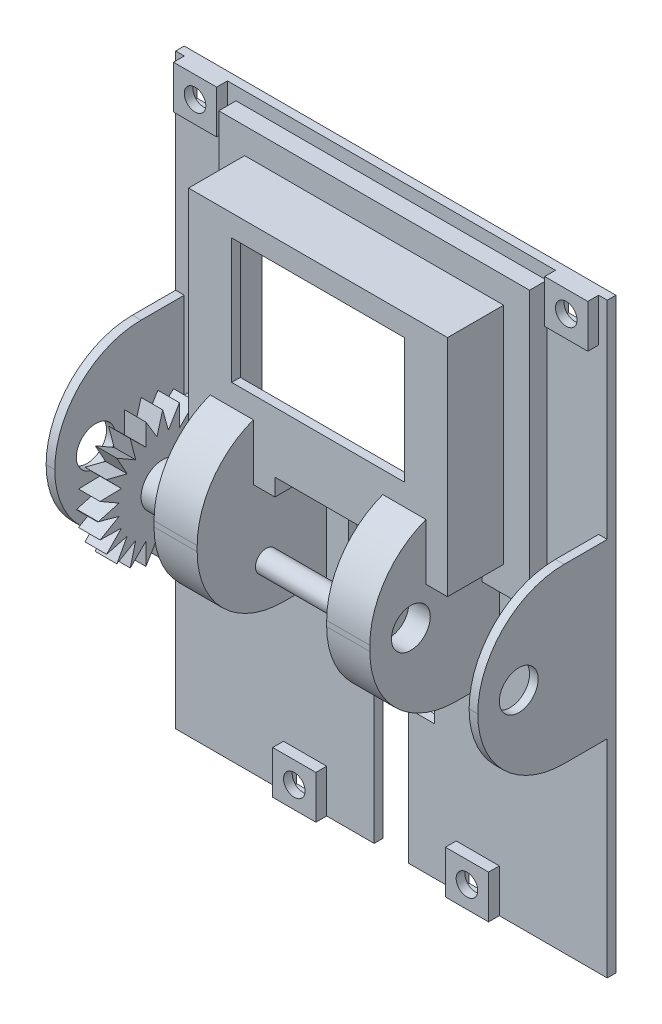
from build123d import *

# Parameters (mm, degrees)
BOSS_EXTRU_1_DEPTH       = 2
BOSS_EXTRU_2_DEPTH       = 4
ESQUISSE3_W              = 68
ESQUISSE3_H              = 60
ESQUISSE3_W_2            = 56
ESQUISSE3_H_2            = 48
BOSS_EXTRU_3_DEPTH       = 2
ESQUISSE4_W              = 60
ESQUISSE4_H              = 52
ESQUISSE4_W_2            = 56
ESQUISSE4_H_2            = 48
BOSS_EXTRU_4_DEPTH       = 13
ESQUISSE5_W              = 56
ESQUISSE5_H              = 48
BOSS_EXTRU_5_DEPTH       = 2
ESQUISSE6_W              = 20
ESQUISSE6_H              = 10
ENL_V_MAT_EXTRU_1_DEPTH  = 35
ESQUISSE9_W              = 2
ESQUISSE9_H              = 40
ESQUISSE9_W_2            = 10
ESQUISSE9_H_2            = 21
BOSS_EXTRU_9_DEPTH       = 30
CONG_5_R                 = 20
ESQUISSE10_W             = 10
ESQUISSE10_H             = 6
BOSS_EXTRU_10_DEPTH      = 26
ESQUISSE11_W             = 10
ESQUISSE11_H             = 13
BOSS_EXTRU_11_DEPTH      = 13
CONG_6_R                 = 20
CONG_7_R                 = 20
ESQUISSE12_R             = 2.5
BOSS_EXTRU_12_DEPTH      = 36
ESQUISSE13_R             = 4.5
ENL_V_MAT_EXTRU_2_DEPTH  = 30
ENL_V_START              = -17
ESQUISSE14_R             = 4.5
ENL_V_MAT_EXTRU_4_DEPTH  = 17
ESQUISSE15_R             = 5
BOSS_EXTRU_13_DEPTH      = 12.5
ESQUISSE16_W             = 1
ESQUISSE16_H             = 1
BOSS_EXTRU_14_DEPTH      = 2
ESQUISSE17_R             = 15
BOSS_EXTRU_16_DEPTH      = 5
ENL_V_START_2            = -16
ESQUISSE18_R             = 4.5
ENL_V_MAT_EXTRU_5_DEPTH  = 16
ENL_V_MAT_EXTRU_7_DEPTH  = 5
ESQUISSE24_W             = 40
ESQUISSE24_H             = 29
ENL_V_MAT_EXTRU_8_DEPTH  = 10
ESQUISSE25_R             = 2.5
ENL_V_MAT_EXTRU_9_DEPTH  = 10
ESQUISSE26_W             = 8
ESQUISSE26_H             = 31
ENL_V_MAT_EXTRU_10_DEPTH = 10
ESQUISSE27_W             = 8
ESQUISSE27_H             = 8
ENL_V_MAT_EXTRU_11_DEPTH = 2.5
ESQUISSE28_W             = 10
ESQUISSE28_H             = 10
ESQUISSE28_W_2           = 8
ESQUISSE28_H_2           = 8
BOSS_EXTRU_17_DEPTH      = 2.5
ESQUISSE29_W             = 8
ESQUISSE29_H             = 8
BOSS_EXTRU_18_DEPTH      = 2
ESQUISSE30_R             = 2.5
ENL_V_MAT_EXTRU_12_DEPTH = 2
ESQUISSE31_W             = 8
ESQUISSE31_H             = 8
ENL_V_MAT_EXTRU_13_DEPTH = 2.5
ESQUISSE32_W             = 10
ESQUISSE32_H             = 10
ESQUISSE32_W_2           = 8
ESQUISSE32_H_2           = 8
BOSS_EXTRU_19_DEPTH      = 2.5
ESQUISSE33_W             = 8
ESQUISSE33_H             = 8
BOSS_EXTRU_20_DEPTH      = 2
ESQUISSE34_R             = 2.5
ENL_V_MAT_EXTRU_14_DEPTH = 2


# Some blends are built 0.0001 mm under size
with BuildPart() as part:
    # Esquisse1 → Boss.-Extru.1 (new body)
    with BuildSketch(Plane.XY):
        Polygon((-50, 68), (-50, -68), (-10, -68), (10, -68), (50, -68), (50, 68), align=None)
        Polygon((-10, 3), (-34, 3), (-34, 63), (34, 63), (34, 3), (10, 3), (10, -37), (-10, -37), align=None, mode=Mode.SUBTRACT)
    extrude(amount=BOSS_EXTRU_1_DEPTH)

    # Esquisse2 → Boss.-Extru.2 (add)
    with BuildSketch(Plane.XY.offset(2)):
        Polygon((36, 65), (-36, 65), (-36, 1), (-10, 1), (-10, 3), (-34, 3), (-34, 63), (34, 63), (34, 3), (10, 3), (10, 1), (36, 1), align=None)
    extrude(amount=BOSS_EXTRU_2_DEPTH)

    # Esquisse3 → Boss.-Extru.3 (add)
    with BuildSketch(Plane.XY.offset(6)):
        with Locations((0, 33)):
            Rectangle(ESQUISSE3_W, ESQUISSE3_H)
        with Locations((0, 33)):
            Rectangle(ESQUISSE3_W_2, ESQUISSE3_H_2, mode=Mode.SUBTRACT)
    extrude(amount=-BOSS_EXTRU_3_DEPTH)

    # Esquisse4 → Boss.-Extru.4 (add)
    with BuildSketch(Plane.XY.offset(6)):
        with Locations((0, 33)):
            Rectangle(ESQUISSE4_W, ESQUISSE4_H)
        with Locations((0, 33)):
            Rectangle(ESQUISSE4_W_2, ESQUISSE4_H_2, mode=Mode.SUBTRACT)
    extrude(amount=BOSS_EXTRU_4_DEPTH)

    # Esquisse5 → Boss.-Extru.5 (add)
    with BuildSketch(Plane.XY.offset(19)):
        with Locations((0, 33)):
            Rectangle(ESQUISSE5_W, ESQUISSE5_H)
    extrude(amount=-BOSS_EXTRU_5_DEPTH)

    # Esquisse6 → Enlèv. mat.-Extru.1 (cut)
    with BuildSketch(Plane.XY.offset(19)):
        with Locations((0, 6)):
            Rectangle(ESQUISSE6_W, ESQUISSE6_H)
    extrude(amount=-ENL_V_MAT_EXTRU_1_DEPTH, mode=Mode.SUBTRACT)

    # Esquisse9 → Boss.-Extru.9 (add)
    with BuildSketch(Plane.XY.offset(2)):
        with Locations((-49, 0)):
            Rectangle(ESQUISSE9_W, ESQUISSE9_H)
        with Locations((49, 0)):
            Rectangle(ESQUISSE9_W, ESQUISSE9_H)
        with Locations((-20, -9.5)):
            Rectangle(ESQUISSE9_W_2, ESQUISSE9_H_2)
        with Locations((20, -9.5)):
            Rectangle(ESQUISSE9_W_2, ESQUISSE9_H_2)
    extrude(amount=BOSS_EXTRU_9_DEPTH)

    # Congé5
    cong_5_edges = [part.edges().sort_by_distance(p)[0] for p in [
        (49, -20, 32),
        (49, 20, 32),
        (-49, -20, 32),
        (-49, 20, 32),
    ]]
    fillet(cong_5_edges, radius=CONG_5_R - 0.0001)  # a hair under: the kernel refuses the full size

    # Esquisse10 → Boss.-Extru.10 (add)
    with BuildSketch(Plane.XY.offset(6)):
        with Locations((-20, 4)):
            Rectangle(ESQUISSE10_W, ESQUISSE10_H)
        with Locations((20, 4)):
            Rectangle(ESQUISSE10_W, ESQUISSE10_H)
    extrude(amount=BOSS_EXTRU_10_DEPTH)

    # Esquisse11 → Boss.-Extru.11 (add)
    with BuildSketch(Plane.XY.offset(19)):
        with Locations((-20, 13.5)):
            Rectangle(ESQUISSE11_W, ESQUISSE11_H)
        with Locations((20, 13.5)):
            Rectangle(ESQUISSE11_W, ESQUISSE11_H)
    extrude(amount=BOSS_EXTRU_11_DEPTH)

    # Congé6
    # the kernel refuses this fillet: 20 mm, written as the material it takes off along each edge
    with BuildSketch(Plane(origin=(71.837484988, 20, 32), x_dir=(0, -1, 0), z_dir=(-1, 0, 0)), Plane(origin=(31.837484988, 20, 32), x_dir=(0, -1, 0), z_dir=(-1, 0, 0))) as cong_6_piece_1:
        with BuildLine():
            CenterArc((18.734993995, -20), CONG_6_R, 90, 69.512684885)
            Line((0, -13), (-0.37469988, -12.86))
            ThreePointArc((-0.37469988, -12.86), (-0.4, -6.5), (-0.4, 0))
            Line((-0.4, 0), (0, 0.4))
            Line((0, 0.4), (18.734993995, 0.4))
            Line((18.734993995, 0.4), (18.734993995, 0))
        make_face()
    extrude(amount=103.674969976, mode=Mode.SUBTRACT)

    # Congé7
    cong_7_edges = [part.edges().sort_by_distance(p)[0] for p in [
        (-20, -20, 32),
        (20, -20, 32),
    ]]
    fillet(cong_7_edges, radius=CONG_7_R)

    # Esquisse12 → Boss.-Extru.12 (add)
    with BuildSketch(Plane(origin=(-15, 0, 0), x_dir=(0, 0, -1), z_dir=(1, 0, 0))):
        with Locations(Location((-16, -9.797958971, 0), (0, 0, 180))):
            Circle(ESQUISSE12_R)
    extrude(amount=BOSS_EXTRU_12_DEPTH)

    # Esquisse13 → Enlèv. mat.-Extru.2 (cut)
    with BuildSketch(Plane(origin=(50, 0, 0), x_dir=(0, 0, -1), z_dir=(1, 0, 0))):
        with Locations((-22.5, 0)):
            Circle(ESQUISSE13_R)
    extrude(amount=-ENL_V_MAT_EXTRU_2_DEPTH, mode=Mode.SUBTRACT)

    # Esquisse14 → Enlèv. mat.-Extru.4 (cut)
    with BuildSketch(Plane.ZY.offset(50).offset(ENL_V_START)):
        with Locations(Location((22.5, 0, 0), (0, 0, 180))):
            Circle(ESQUISSE14_R)
    extrude(amount=ENL_V_MAT_EXTRU_4_DEPTH, mode=Mode.SUBTRACT)

    # Esquisse15 → Boss.-Extru.13 (add)
    with BuildSketch(Plane.ZY.offset(25)):
        with Locations(Location((22.5, 0, 0), (0, 0, 180))):
            Circle(ESQUISSE15_R)
    extrude(amount=BOSS_EXTRU_13_DEPTH)

    # Esquisse16 → Boss.-Extru.14 (add)
    with BuildSketch(Plane.XY.offset(2)):
        with Locations((-37, 0.5)):
            Rectangle(ESQUISSE16_W, ESQUISSE16_H)
        with Locations((-37, -0.5)):
            Rectangle(ESQUISSE16_W, ESQUISSE16_H)
    extrude(amount=BOSS_EXTRU_14_DEPTH)

    # Esquisse17 → Boss.-Extru.16 (add)
    with BuildSketch(Plane.ZY.offset(37.5)):
        with Locations((22.5, 0)):
            Circle(ESQUISSE17_R)
    extrude(amount=-BOSS_EXTRU_16_DEPTH)

    # Esquisse18 → Enlèv. mat.-Extru.5 (cut)
    with BuildSketch(Plane.ZY.offset(50).offset(ENL_V_START_2)):
        with Locations(Location((22.5, 0, 0), (0, 0, 180))):
            Circle(ESQUISSE18_R)
    extrude(amount=ENL_V_MAT_EXTRU_5_DEPTH, mode=Mode.SUBTRACT)

    # Esquisse23 → Enlèv. mat.-Extru.7 (cut)
    with BuildSketch(Plane.ZY.offset(37.5)):
        with BuildLine():
            Line((16.249201679, 8.084145326), (14.992638885, 12.986128333))
            ThreePointArc((14.992638885, 12.986128333), (13.360150213, 11.893828058), (11.884385152, 10.597580922))
            Line((11.884385152, 10.597580922), (16.249201679, 8.084145326))
        make_face()
        with BuildLine():
            Line((18.613608679, 9.438661561), (18.613608679, 14.487786667))
            ThreePointArc((18.613608679, 14.487786667), (16.753858418, 13.855751763), (14.992638885, 12.986128333))
            Line((14.992638885, 12.986128333), (18.613608679, 9.438661561))
        make_face()
        with BuildLine():
            Line((21.172520791, 10.263058131), (22.5, 15))
            ThreePointArc((22.5, 15), (20.54, 14.871395362), (18.613608679, 14.487786667))
            Line((18.613608679, 14.487786667), (21.172520791, 10.263058131))
        make_face()
        with BuildLine():
            ThreePointArc((26.386391321, 14.487786667), (24.46, 14.871395362), (22.5, 15))
            Line((22.5, 15), (23.827479209, 10.263058131))
            Line((23.827479209, 10.263058131), (26.386391321, 14.487786667))
        make_face()
        with BuildLine():
            ThreePointArc((30.007361115, 12.986128333), (28.246141582, 13.855751763), (26.386391321, 14.487786667))
            Line((26.386391321, 14.487786667), (26.386391321, 9.438661561))
            Line((26.386391321, 9.438661561), (30.007361115, 12.986128333))
        make_face()
        with BuildLine():
            ThreePointArc((33.115614848, 10.597580922), (31.639849787, 11.893828058), (30.007361115, 12.986128333))
            Line((30.007361115, 12.986128333), (28.750798321, 8.084145326))
            Line((28.750798321, 8.084145326), (33.115614848, 10.597580922))
        make_face()
        with BuildLine():
            ThreePointArc((36.994373579, 3.861752784), (36.365501637, 5.722574977), (35.498873985, 7.485270545))
            Line((35.498873985, 7.485270545), (32.044534805, 3.971329591))
            Line((32.044534805, 3.971329591), (36.994373579, 3.861752784))
        make_face()
        with BuildLine():
            ThreePointArc((35.498873985, 7.485270545), (34.409350934, 9.119614045), (33.115614848, 10.597580922))
            Line((33.115614848, 10.597580922), (30.731443888, 6.271833446))
            Line((30.731443888, 6.271833446), (35.498873985, 7.485270545))
        make_face()
        with BuildLine():
            ThreePointArc((37.499978319, 0.025503813), (37.371395362, 1.96), (36.994373579, 3.861752784))
            Line((36.994373579, 3.861752784), (32.629557052, 1.348317188))
            Line((32.629557052, 1.348317188), (37.40956311, 0))
            Line((37.40956311, 0), (37.499978319, 0.025503813))
        make_face()
        with BuildLine():
            Line((37.499978319, -0.025503813), (37.40956311, 0))
            Line((37.40956311, 0), (32.629557052, -1.348317188))
            Line((32.629557052, -1.348317188), (36.994373579, -3.861752784))
            ThreePointArc((36.994373579, -3.861752784), (37.371395362, -1.96), (37.499978319, -0.025503813))
        make_face()
        with BuildLine():
            ThreePointArc((35.498873985, -7.485270545), (36.365501637, -5.722574977), (36.994373579, -3.861752784))
            Line((36.994373579, -3.861752784), (32.044534805, -3.971329591))
            Line((32.044534805, -3.971329591), (35.498873985, -7.485270545))
        make_face()
        with BuildLine():
            ThreePointArc((33.115614848, -10.597580922), (34.409350934, -9.119614045), (35.498873985, -7.485270545))
            Line((35.498873985, -7.485270545), (30.731443888, -6.271833446))
            Line((30.731443888, -6.271833446), (33.115614848, -10.597580922))
        make_face()
        with BuildLine():
            ThreePointArc((30.007361115, -12.986128333), (31.639849787, -11.893828058), (33.115614848, -10.597580922))
            Line((33.115614848, -10.597580922), (28.750798321, -8.084145326))
            Line((28.750798321, -8.084145326), (30.007361115, -12.986128333))
        make_face()
        with BuildLine():
            ThreePointArc((26.386391321, -14.487786667), (28.246141582, -13.855751763), (30.007361115, -12.986128333))
            Line((30.007361115, -12.986128333), (26.386391321, -9.438661561))
            Line((26.386391321, -9.438661561), (26.386391321, -14.487786667))
        make_face()
        with BuildLine():
            ThreePointArc((22.5, -15), (24.46, -14.871395362), (26.386391321, -14.487786667))
            Line((26.386391321, -14.487786667), (23.821374155, -10.252978772))
            Line((23.821374155, -10.252978772), (22.5, -15))
        make_face()
        with BuildLine():
            Line((21.172520791, -10.263058131), (18.613608679, -14.487786667))
            ThreePointArc((18.613608679, -14.487786667), (20.54, -14.871395362), (22.5, -15))
            Line((22.5, -15), (21.172520791, -10.263058131))
        make_face()
        with BuildLine():
            Line((18.613608679, -9.438661561), (14.992638885, -12.986128333))
            ThreePointArc((14.992638885, -12.986128333), (16.753858418, -13.855751763), (18.613608679, -14.487786667))
            Line((18.613608679, -14.487786667), (18.613608679, -9.438661561))
        make_face()
        with BuildLine():
            Line((16.249201679, -8.084145326), (11.884385152, -10.597580922))
            ThreePointArc((11.884385152, -10.597580922), (13.360150213, -11.893828058), (14.992638885, -12.986128333))
            Line((14.992638885, -12.986128333), (16.249201679, -8.084145326))
        make_face()
        with BuildLine():
            Line((14.268556112, -6.271833446), (9.501126015, -7.485270545))
            ThreePointArc((9.501126015, -7.485270545), (10.590649066, -9.119614045), (11.884385152, -10.597580922))
            Line((11.884385152, -10.597580922), (14.268556112, -6.271833446))
        make_face()
        with BuildLine():
            Line((12.955465195, -3.971329591), (8.005626421, -3.861752784))
            ThreePointArc((8.005626421, -3.861752784), (8.634498363, -5.722574977), (9.501126015, -7.485270545))
            Line((9.501126015, -7.485270545), (12.955465195, -3.971329591))
        make_face()
        with BuildLine():
            Line((12.342295627, -1.364525539), (7.500021681, -0.025503813))
            ThreePointArc((7.500021681, -0.025503813), (7.628604638, -1.96), (8.005626421, -3.861752784))
            Line((8.005626421, -3.861752784), (12.342295627, -1.364525539))
        make_face()
        with BuildLine():
            Line((12.370442948, 1.348317188), (8.005626421, 3.861752784))
            ThreePointArc((8.005626421, 3.861752784), (7.628604638, 1.96), (7.500021681, 0.025503813))
            Line((7.500021681, 0.025503813), (7.59043689, 0))
            Line((7.59043689, 0), (12.370442948, 1.348317188))
        make_face()
        with BuildLine():
            Line((12.955465195, 3.971329591), (9.501126015, 7.485270545))
            ThreePointArc((9.501126015, 7.485270545), (8.634498363, 5.722574977), (8.005626421, 3.861752784))
            Line((8.005626421, 3.861752784), (12.955465195, 3.971329591))
        make_face()
        with BuildLine():
            Line((14.268556112, 6.271833446), (11.884385152, 10.597580922))
            ThreePointArc((11.884385152, 10.597580922), (10.590649066, 9.119614045), (9.501126015, 7.485270545))
            Line((9.501126015, 7.485270545), (14.268556112, 6.271833446))
        make_face()
    extrude(amount=-ENL_V_MAT_EXTRU_7_DEPTH, mode=Mode.SUBTRACT)


with BuildPart() as enl_v_mat_extru_7_piece_1:
    # of the separate pieces the step leaves, piece 1, a body of its own (enl_v_mat_extru_7_pieces)
    add(part.part.solids().sort_by_distance((15, 0, 32))[0])

    # Esquisse24 → Enlèv. mat.-Extru.8 (cut)
    with BuildSketch(Plane.XY.offset(19)):
        with Locations((0, 39.5)):
            Rectangle(ESQUISSE24_W, ESQUISSE24_H)
    extrude(amount=-ENL_V_MAT_EXTRU_8_DEPTH, mode=Mode.SUBTRACT)

    # Esquisse25 → Enlèv. mat.-Extru.9 (cut)
    with BuildSketch(Plane.XY.offset(2)):
        with Locations((-43, 63)):
            Circle(ESQUISSE25_R)
        with Locations((43, 63)):
            Circle(ESQUISSE25_R)
    extrude(amount=-ENL_V_MAT_EXTRU_9_DEPTH, mode=Mode.SUBTRACT)

    # Esquisse26 → Enlèv. mat.-Extru.10 (cut)
    with BuildSketch(Plane.XY.offset(2)):
        with Locations((0, -52.5)):
            Rectangle(ESQUISSE26_W, ESQUISSE26_H)
    extrude(amount=-ENL_V_MAT_EXTRU_10_DEPTH, mode=Mode.SUBTRACT)

    # Esquisse27 → Enlèv. mat.-Extru.11 (cut)
    with BuildSketch(Plane(origin=(0, 0, 0), x_dir=(-1, 0, 0), z_dir=(0, 0, -1))):
        with Locations((-20, -63)):
            Rectangle(ESQUISSE27_W, ESQUISSE27_H)
        with Locations((20, -63)):
            Rectangle(ESQUISSE27_W, ESQUISSE27_H)
    extrude(amount=-ENL_V_MAT_EXTRU_11_DEPTH, mode=Mode.SUBTRACT)

    # Esquisse28 → Boss.-Extru.17 (add)
    # profile 1 of 2: a face of its own
    with BuildSketch(Plane.XY.offset(2)):
        with Locations((-20, -63)):
            Rectangle(ESQUISSE28_W, ESQUISSE28_H)
        with Locations((-20, -63)):
            Rectangle(ESQUISSE28_W_2, ESQUISSE28_H_2, mode=Mode.SUBTRACT)
    # profile 2 of 2: a face of its own
    with BuildSketch(Plane.XY.offset(2)):
        with Locations((20, -63)):
            Rectangle(ESQUISSE28_W, ESQUISSE28_H)
        with Locations((20, -63)):
            Rectangle(ESQUISSE28_W_2, ESQUISSE28_H_2, mode=Mode.SUBTRACT)
    extrude(amount=BOSS_EXTRU_17_DEPTH)

    # Esquisse29 → Boss.-Extru.18 (add)
    with BuildSketch(Plane.XY.offset(4.5)):
        with Locations((-20, -63)):
            Rectangle(ESQUISSE29_W, ESQUISSE29_H)
        with Locations((20, -63)):
            Rectangle(ESQUISSE29_W, ESQUISSE29_H)
    extrude(amount=-BOSS_EXTRU_18_DEPTH)

    # Esquisse30 → Enlèv. mat.-Extru.12 (cut)
    with BuildSketch(Plane.XY.offset(4.5)):
        with Locations((-20, -63)):
            Circle(ESQUISSE30_R)
        with Locations(Location((20, -63, 0), (0, 0, 180))):
            Circle(ESQUISSE30_R)
    extrude(amount=-ENL_V_MAT_EXTRU_12_DEPTH, mode=Mode.SUBTRACT)

    # Esquisse31 → Enlèv. mat.-Extru.13 (cut)
    with BuildSketch(Plane(origin=(0, 0, 0), x_dir=(-1, 0, 0), z_dir=(0, 0, -1))):
        with Locations((-43, 63)):
            Rectangle(ESQUISSE31_W, ESQUISSE31_H)
        with Locations((43, 63)):
            Rectangle(ESQUISSE31_W, ESQUISSE31_H)
    extrude(amount=-ENL_V_MAT_EXTRU_13_DEPTH, mode=Mode.SUBTRACT)

    # Esquisse32 → Boss.-Extru.19 (add)
    # profile 1 of 2: a face of its own
    with BuildSketch(Plane.XY.offset(2)):
        with Locations((43, 63)):
            Rectangle(ESQUISSE32_W, ESQUISSE32_H)
        with Locations((43, 63)):
            Rectangle(ESQUISSE32_W_2, ESQUISSE32_H_2, mode=Mode.SUBTRACT)
    # profile 2 of 2: a face of its own
    with BuildSketch(Plane.XY.offset(2)):
        with Locations((-43, 63)):
            Rectangle(ESQUISSE32_W, ESQUISSE32_H)
        with Locations((-43, 63)):
            Rectangle(ESQUISSE32_W_2, ESQUISSE32_H_2, mode=Mode.SUBTRACT)
    extrude(amount=BOSS_EXTRU_19_DEPTH)

    # Esquisse33 → Boss.-Extru.20 (add)
    with BuildSketch(Plane.XY.offset(4.5)):
        with Locations((-43, 63)):
            Rectangle(ESQUISSE33_W, ESQUISSE33_H)
        with Locations((43, 63)):
            Rectangle(ESQUISSE33_W, ESQUISSE33_H)
    extrude(amount=-BOSS_EXTRU_20_DEPTH)

    # Esquisse34 → Enlèv. mat.-Extru.14 (cut)
    with BuildSketch(Plane.XY.offset(4.5)):
        with Locations((-43, 63)):
            Circle(ESQUISSE34_R)
        with Locations((43, 63)):
            Circle(ESQUISSE34_R)
    extrude(amount=-ENL_V_MAT_EXTRU_14_DEPTH, mode=Mode.SUBTRACT)


with BuildPart() as enl_v_mat_extru_7_piece_2:
    # of the separate pieces the step leaves, piece 2, a body of its own (enl_v_mat_extru_7_pieces)
    add(part.part.solids().sort_by_distance((-32.5, -0.025503813, 37.499978319))[0])


solid = Compound([enl_v_mat_extru_7_piece_1.part, enl_v_mat_extru_7_piece_2.part])
